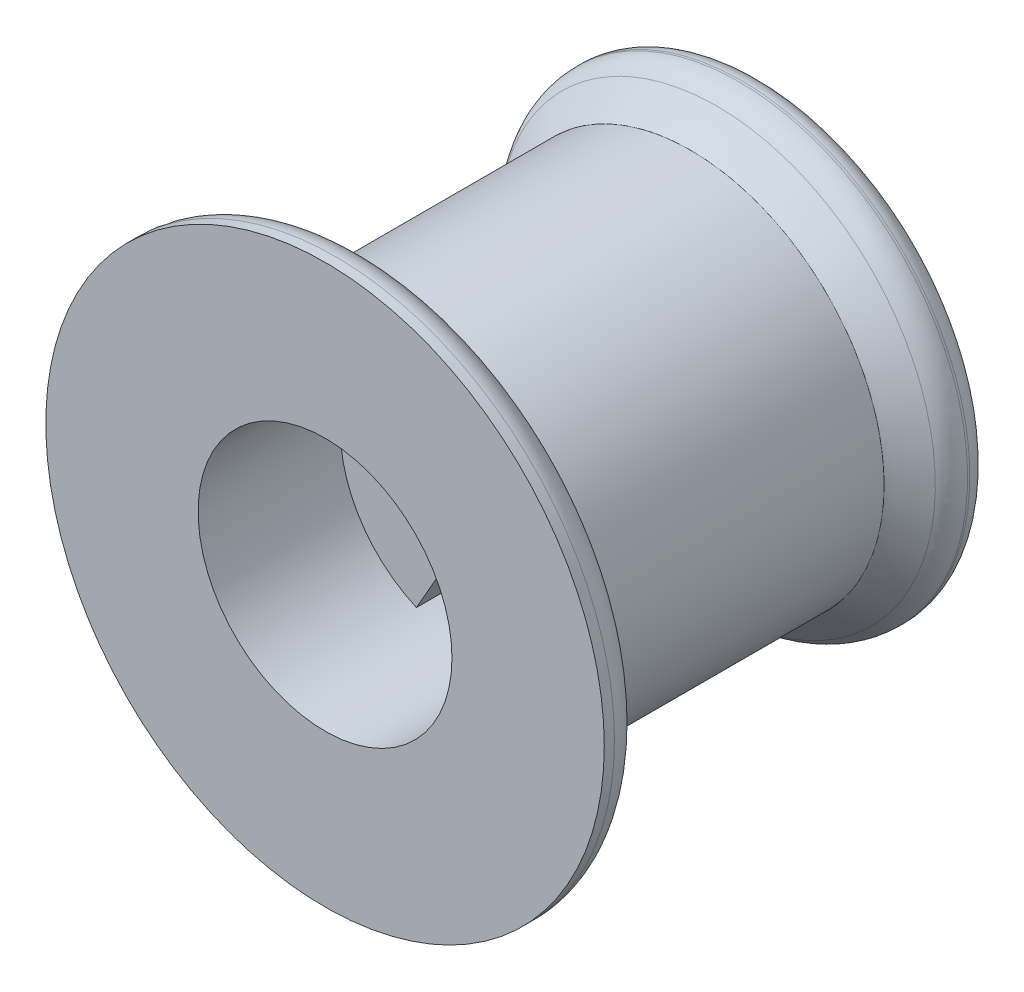
from build123d import *

# Parameters (mm, degrees)
BOSS_EXTRUDE1_DEPTH   = 10.8
BOSS_EXTRUDE1_2_DEPTH = 10.8
SKETCH2_6_R           = 19.049999999999997
SKETCH2_6_R_2         = 12.499999999999998
BOSS_EXTRUDE3_DEPTH   = 10
BOSS_EXTRUDE4_START   = 4
SKETCH4_R             = 27.499999999999996
SKETCH4_R_2           = 12.5
BOSS_EXTRUDE4_DEPTH   = 4
SKETCH5_R             = 19.049999999999997
SKETCH5_R_2           = 12.500000000000004
BOSS_EXTRUDE5_DEPTH   = 10.8
BOSS_EXTRUDE6_START   = 14.2
SKETCH6_R             = 19.049999999999997
BOSS_EXTRUDE6_DEPTH   = 14.2
SKETCH7_R             = 22.5
BOSS_EXTRUDE7_DEPTH   = 4
FILLET1_R             = 3
FILLET2_SIZE          = 3
FILLET3_R             = 3
FILLET5_R             = 2
FILLET6_R             = 4


with BuildPart() as part:
    # Sketch2 → Boss-Extrude1 (new body)
    with BuildSketch(Plane.XY):
        with BuildLine():
            ThreePointArc((-4.999999999999999, 11.456439237389597), (-12.499999999999998, 1.53e-15), (-5, -11.456439237389597))
            Line((-5, -11.456439237389601), (-2, -6.184658438426491))
            ThreePointArc((-1.9999999999999991, -6.184658438426491), (-6.5, 8e-16), (-2.0000000000000004, 6.184658438426491))
            Line((-2, 6.184658438426491), (-5, 11.456439237389601))
        make_face()
    extrude(amount=-BOSS_EXTRUDE1_DEPTH)



with BuildPart() as body_2:
    # Sketch2 → Boss-Extrude1 2 (new body)
    with BuildSketch(Plane.XY):
        with BuildLine():
            Line((2, -6.184658438426491), (5, -11.456439237389601))
            ThreePointArc((4.999999999999996, -11.4564392373896), (10.458250331675938, -6.846531968814583), (12.499999999999998, -3.06e-15))
            ThreePointArc((12.499999999999998, 0), (10.458250331675943, 6.846531968814577), (4.999999999999998, 11.4564392373896))
            Line((5, 11.456439237389601), (2, 6.184658438426491))
            ThreePointArc((1.9999999999999998, 6.184658438426491), (5.25594901040716, 3.824264635194589), (6.5, 0))
            ThreePointArc((6.5, -1.59e-15), (5.255949010407158, -3.82426463519459), (1.999999999999997, -6.184658438426491))
        make_face()
    extrude(amount=-BOSS_EXTRUDE1_2_DEPTH)


with BuildPart() as body_3:
    # Sketch2<6> → Boss-Extrude3 (new body)
    with BuildSketch(Plane.XY):
        Circle(SKETCH2_6_R)
        Circle(SKETCH2_6_R_2, mode=Mode.SUBTRACT)
    extrude(amount=BOSS_EXTRUDE3_DEPTH)

    # Sketch4 → Boss-Extrude4 (add)
    with BuildSketch(Plane.XY.offset(10).offset(BOSS_EXTRUDE4_START)):
        Circle(SKETCH4_R)
        Circle(SKETCH4_R_2, mode=Mode.SUBTRACT)
    extrude(amount=-BOSS_EXTRUDE4_DEPTH)


with BuildPart() as part_1:
    add(part.part)

    add(body_2.part)  # Boss-Extrude5 merges body 2

    add(body_3.part)  # Boss-Extrude5 merges body 3
    # Sketch5 → Boss-Extrude5 (add)
    with BuildSketch(Plane(origin=(0, 0, 0), x_dir=(-1, 0, 0), z_dir=(0, 0, -1))):
        with Locations(Location((0, 0, 0), (0, 0, 180))):
            Circle(SKETCH5_R)
        with Locations(Location((0, 0, 0), (0, 0, 180))):
            Circle(SKETCH5_R_2, mode=Mode.SUBTRACT)
    extrude(amount=BOSS_EXTRUDE5_DEPTH)

    # Sketch6 → Boss-Extrude6 (add)
    with BuildSketch(Plane(origin=(0, 0, -10.8), x_dir=(-1, 0, 0), z_dir=(0, 0, -1)).offset(BOSS_EXTRUDE6_START)):
        with Locations(Location((0, 0, 0), (0, 0, 180))):
            Circle(SKETCH6_R)
    extrude(amount=-BOSS_EXTRUDE6_DEPTH)

    # Sketch7 → Boss-Extrude7 (add)
    with BuildSketch(Plane(origin=(0, 0, -25), x_dir=(-1, 0, 0), z_dir=(0, 0, -1))):
        Circle(SKETCH7_R)
    extrude(amount=BOSS_EXTRUDE7_DEPTH)

    # Fillet1
    fillet1_edges = [part_1.edges().sort_by_distance(p)[0] for p in [
        (-27.499999999999996, 3.37e-15, 10),
    ]]
    fillet(fillet1_edges, radius=FILLET1_R)

    # Fillet2
    # a fillet whose section is not a circle: 3 mm, written as the material it adds along each edge
    with BuildSketch(Plane(origin=(0, 0, -25), x_dir=(1, 1.2e-16, 0), z_dir=(-1.2e-16, 1, 0))) as fillet2_piece_1:
        with BuildLine():
            Bezier((19.049999999999997, -FILLET2_SIZE), (19.049999999999997, 0), (19.049999999999997 + FILLET2_SIZE, 0), weights=[1, 0.04242640687119285, 1])
            Line((19.049999999999997 + FILLET2_SIZE, 0), (19.049999999999997, 0))
            Line((19.049999999999997, 0), (19.049999999999997, -FILLET2_SIZE))
        make_face()
    revolve(axis=Axis((0, 0, -25), (0, 0, -1)))

    # Fillet3
    fillet3_edges = [part_1.edges().sort_by_distance(p)[0] for p in [
        (22.5, 2.76e-15, -25),
    ]]
    fillet(fillet3_edges, radius=FILLET3_R)

    # Fillet5
    fillet5_edges = [part_1.edges().sort_by_distance(p)[0] for p in [
        (22.5, 2.76e-15, -29),
    ]]
    fillet(fillet5_edges, radius=FILLET5_R)

    # Fillet6
    fillet6_edges = [part_1.edges().sort_by_distance(p)[0] for p in [
        (-19.049999999999997, 2.33e-15, 10),
    ]]
    fillet(fillet6_edges, radius=FILLET6_R)


solid = part_1.part
